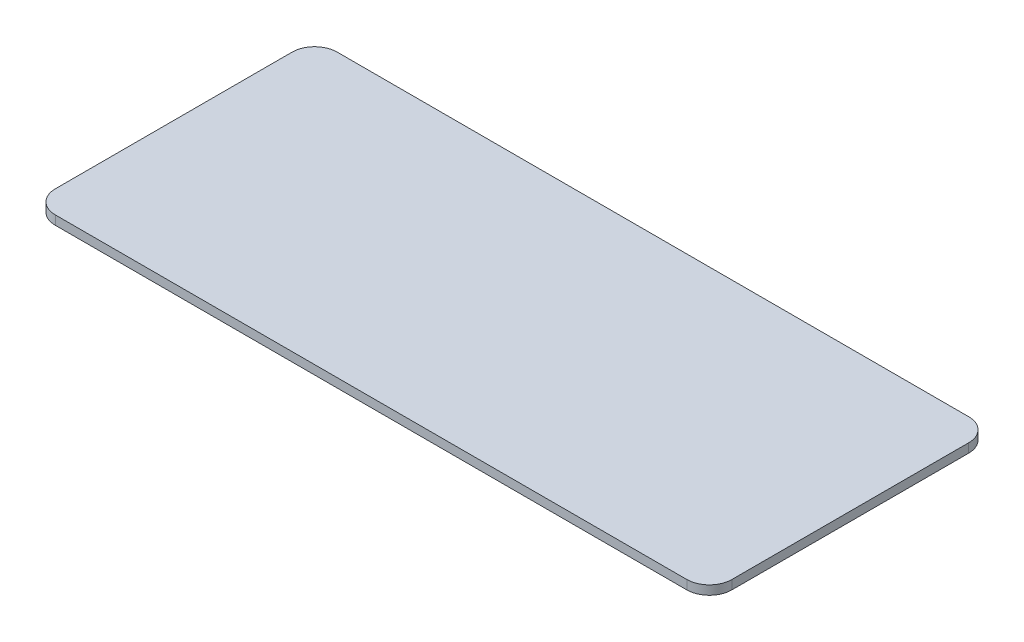
from build123d import *

# Parameters (mm, degrees)
SKETCH1_W           = 120
SKETCH1_H           = 50
BOSS_EXTRUDE1_DEPTH = 1.6
FILLET1_R           = 4


with BuildPart() as part:
    # Sketch1 → Boss-Extrude1 (new body)
    with BuildSketch(Plane(origin=(0, 0, 0), x_dir=(1, 0, 0), z_dir=(0, 1, 0))):
        Rectangle(SKETCH1_W, SKETCH1_H)
    extrude(amount=BOSS_EXTRUDE1_DEPTH)

    # Fillet1
    fillet1_edges = [part.edges().sort_by_distance(p)[0] for p in [
        (60, 0.8, 25),
        (60, 0.8, -25),
        (-60, 0.8, -25),
        (-60, 0.8, 25),
    ]]
    fillet(fillet1_edges, radius=FILLET1_R)


solid = part.part
